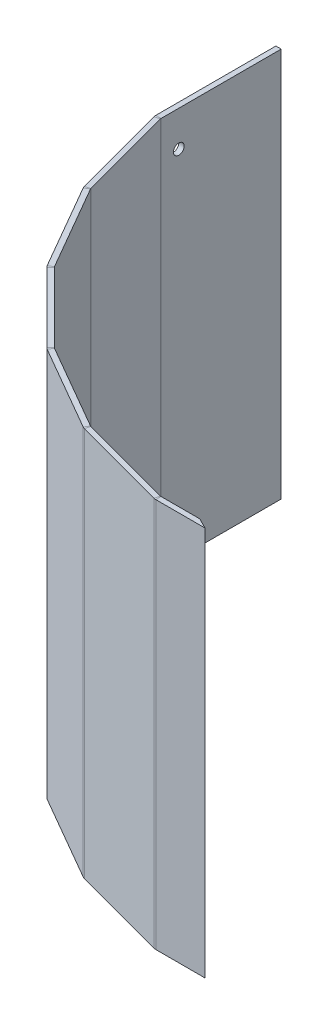
from build123d import *

# Parameters (mm, degrees)
BASE_FLANGE1_DEPTH          = 110
CHAMFER1_SIZE2              = 3
CHAMFER1_SIZE               = 1.5
F_3_0MM_PRESS_DOWEL_HOLE1_D = 3


# Sheet-metal steps are written as plain solids
with BuildPart() as part:
    # Sketch1 → Base-Flange1 (new body)
    with BuildSketch(Plane(origin=(0, 0, 0), x_dir=(1, 0, 0), z_dir=(0, 1, 0))):
        with BuildLine():
            Line((0, 0), (0, -20))
            Line((0, -20), (0, -33.90302477))
            ThreePointArc((0, -33.90302477), (0.006301715, -33.999170363), (0.025099036, -34.093670879))
            Line((0.025099036, -34.093670879), (7.221834227, -60.952252257))
            ThreePointArc((7.221834227, -60.952252257), (7.252805527, -61.043490765), (7.295420878, -61.129906149))
            Line((7.295420878, -61.129906149), (21.198445648, -85.21065143))
            ThreePointArc((21.198445648, -85.21065143), (21.25197589, -85.290765098), (21.315505105, -85.363206285))
            Line((21.315505105, -85.363206285), (40.977351294, -105.025052473))
            ThreePointArc((40.977351294, -105.025052473), (41.04979248, -105.088581688), (41.129906149, -105.14211193))
            Line((41.129906149, -105.14211193), (65.21065143, -119.0451367))
            ThreePointArc((65.21065143, -119.0451367), (65.297066813, -119.087752052), (65.388305321, -119.118723352))
            Line((65.388305321, -119.118723352), (92.246886699, -126.315458542))
            ThreePointArc((92.246886699, -126.315458542), (92.341387215, -126.334255863), (92.437532808, -126.340557578))
            Line((92.437532808, -126.340557578), (106.340557578, -126.340557578))
            Line((106.340557578, -126.340557578), (106.340557578, -127.840557578))
            Line((106.340557578, -127.840557578), (92.437532808, -127.840557578))
            ThreePointArc((92.437532808, -127.840557578), (92.145597926, -127.821423155), (91.858658132, -127.764347281))
            Line((91.858658132, -127.764347281), (65.000076753, -120.567612091))
            ThreePointArc((65.000076753, -120.567612091), (64.723041665, -120.47357135), (64.46065143, -120.344174806))
            Line((64.46065143, -120.344174806), (40.379906149, -106.441150036))
            ThreePointArc((40.379906148, -106.441150036), (40.136650336, -106.278611699), (39.916691122, -106.085712644))
            Line((39.916691122, -106.085712645), (20.254844934, -86.423866456))
            ThreePointArc((20.254844934, -86.423866456), (20.06194588, -86.203907242), (19.899407542, -85.96065143))
            Line((19.899407542, -85.96065143), (5.996382772, -61.879906149))
            ThreePointArc((5.996382772, -61.879906149), (5.866986228, -61.617515913), (5.772945487, -61.340480825))
            Line((5.772945487, -61.340480825), (-1.423789703, -34.481899447))
            ThreePointArc((-1.423789703, -34.481899447), (-1.480865577, -34.194959652), (-1.5, -33.90302477))
            Line((-1.5, -33.90302477), (-1.5, -20))
            Line((-1.5, -20), (-1.5, 0))
            Line((-1.5, 0), (0, 0))
        make_face()
    extrude(amount=BASE_FLANGE1_DEPTH)

    # Chamfer1
    chamfer1_edges = [part.edges().sort_by_distance(p)[0] for p in [
        (106.340557578, 55, 126.340557578),
    ]]
    chamfer1_side = [part.faces().sort_by_distance(p)[0] for p in [
        (106.340557578, 55, 126.370557578),
    ]]
    chamfer(chamfer1_edges, length=CHAMFER1_SIZE - 0.0001, length2=CHAMFER1_SIZE2 - 0.0001, reference=chamfer1_side[0])  # a hair under: the kernel refuses the full size

    # Ø3.0mm Press Dowel Hole1 (through all)
    with Locations(Plane(origin=(-3, -55.405236378, -125.638352017), x_dir=(0, 0, 1), z_dir=(-1, 0, 0))):
        with Locations((154.541376787, 155.405236378), (154.541376787, 65.405236378)):
            Hole(F_3_0MM_PRESS_DOWEL_HOLE1_D / 2)


solid = part.part
